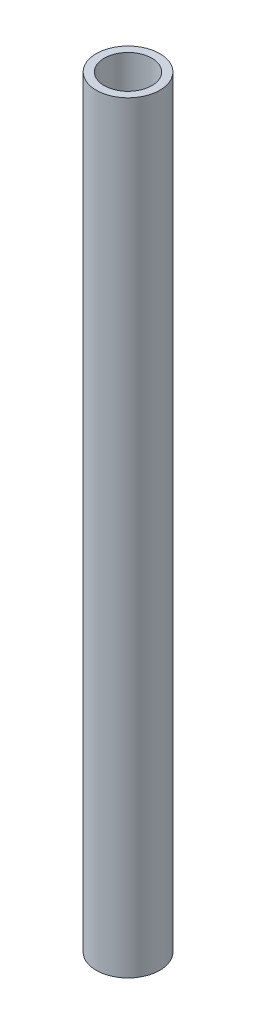
from build123d import *

# Parameters (mm, degrees)
SKETCH2_R           = 25.4
SKETCH2_R_2         = 19.05
BOSS_EXTRUDE1_DEPTH = 609.6


with BuildPart() as part:
    # Sketch2 → Boss-Extrude1 (new body)
    with BuildSketch(Plane(origin=(0, 0, 0), x_dir=(1, 0, 0), z_dir=(0, 1, 0))):
        Circle(SKETCH2_R)
        Circle(SKETCH2_R_2, mode=Mode.SUBTRACT)
    extrude(amount=BOSS_EXTRUDE1_DEPTH)


solid = part.part
